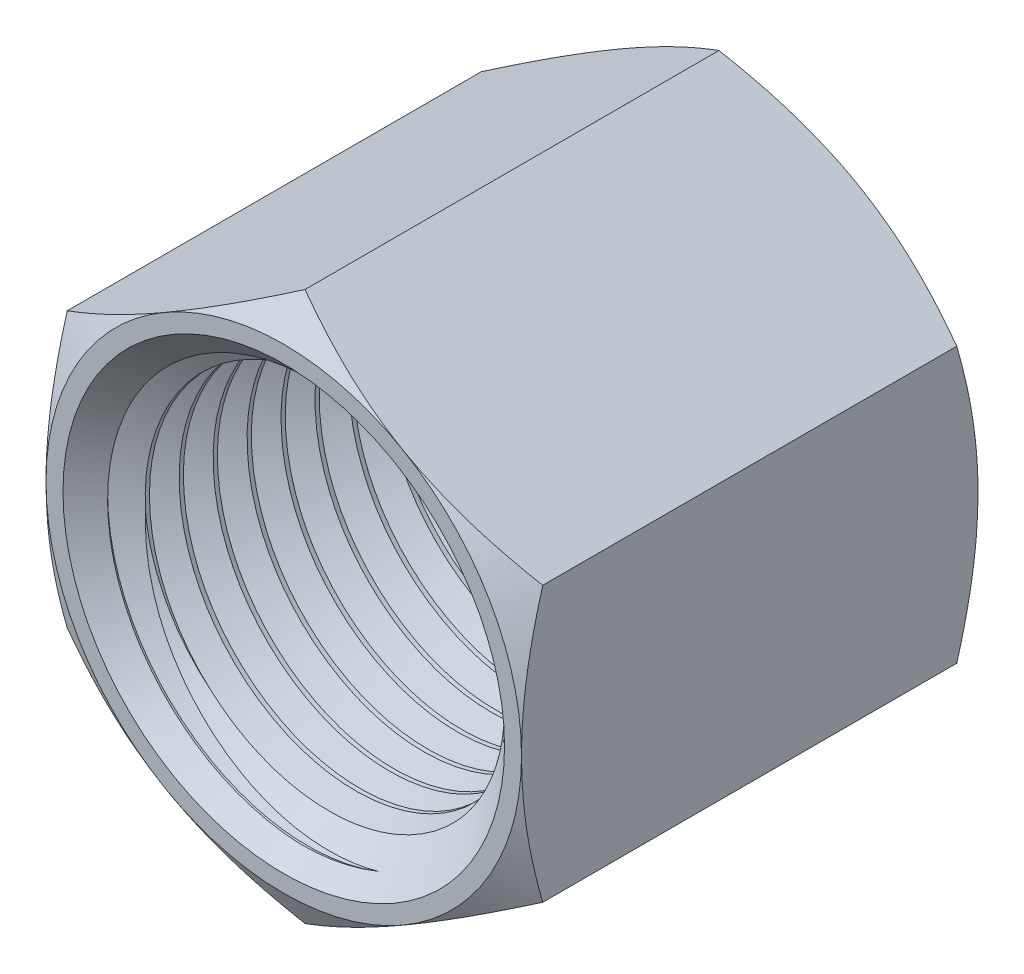
from build123d import *

# Parameters (mm, degrees)
BOSS_EXTRUDE1_DEPTH      = 10.668
BOSS_EXTRUDE1_DEPTH_BACK = 10.668
SKETCH2_R                = 7.239
SKETCH4_OUTSIDE_W        = 41.044
SKETCH4_OUTSIDE_H        = 44.482
SKETCH4_OUTSIDE_R        = 11.1125
CUT_EXTRUDE1_DEPTH       = 2.54
CUT_EXTRUDE1_DRAFT       = -60
MIRROR1_COPY_1_SKETCH_W  = 41.044
MIRROR1_COPY_1_SKETCH_H  = 44.482
MIRROR1_COPY_1_SKETCH_R  = 11.1125
MIRROR1_COPY_1_DEPTH     = 2.54
MIRROR1_COPY_1_DRAFT     = -60
SKETCH7_R                = 10.31875
BOSS_EXTRUDE2_DEPTH      = 15.748
SKETCH8_R                = 9.525
BOSS_EXTRUDE3_DEPTH      = 15.748
CUT_SWEEP1_PITCH         = 1.5875


with BuildPart() as part:
    # Sketch2 → Boss-Extrude1 (new, two sides: drawn at the far end of the back side and taken through both)
    with BuildSketch(Plane.XY.offset(-BOSS_EXTRUDE1_DEPTH_BACK)):
        Polygon((0, 12.831609733), (-11.1125, 6.415804866), (-11.1125, -6.415804866), (0, -12.831609733), (11.1125, -6.415804866), (11.1125, 6.415804866), align=None)
        Circle(SKETCH2_R, mode=Mode.SUBTRACT)
    extrude(amount=BOSS_EXTRUDE1_DEPTH + BOSS_EXTRUDE1_DEPTH_BACK)

    # Sketch3 → Cut-Revolve1 (revolve, cut)
    with BuildSketch(Plane(origin=(0, 0, 0), x_dir=(0, 0, -1), z_dir=(1, 0, 0)), mode=Mode.PRIVATE) as cut_revolve1_sk:
        Polygon((-10.668, 9.525), (5.08, 9.525), (5.08, 7.239), (10.668, 7.239), (10.668, 0), (-10.668, 0), align=None)
    revolve(cut_revolve1_sk.sketch.rotate(Axis((0, 0, 10.668), (0, 0, -1)), 180), axis=Axis((0, 0, 10.668), (0, 0, -1)), mode=Mode.SUBTRACT)


with BuildPart() as cut_extrude1_tool:
    # Sketch4 outside → Cut-Extrude1 (with draft: the straight prism first)
    with BuildSketch(Plane.XY.offset(10.668)):
        Rectangle(SKETCH4_OUTSIDE_W, SKETCH4_OUTSIDE_H)
        Circle(SKETCH4_OUTSIDE_R, mode=Mode.SUBTRACT)
    extrude(amount=-CUT_EXTRUDE1_DEPTH)
    # Cut-Extrude1: the draft: its side faces are tilted about the plane it starts from
    cut_extrude1_sides = [cut_extrude1_tool.faces().sort_by_distance(p)[0] for p in [
        (0, -22.241, 9.398),
        (20.522, 0, 9.398),
        (0, 22.241, 9.398),
        (-20.522, 0, 9.398),
        (-11.1125, 0, 9.398),
    ]]
    draft(cut_extrude1_sides, Plane.XY.offset(10.668), CUT_EXTRUDE1_DRAFT)


with BuildPart() as part_1:
    add(part.part)

    # Cut-Extrude1: cut by cut_extrude1_tool
    add(cut_extrude1_tool.part, mode=Mode.SUBTRACT)


with BuildPart() as mirror1_copy_1_tool:
    # Mirror1 copy 1 sketch → Mirror1 copy 1 (with draft: the straight prism first)
    with BuildSketch(Plane(origin=(0, 0, -10.668), x_dir=(1, 0, 0), z_dir=(0, 0, -1))):
        Rectangle(MIRROR1_COPY_1_SKETCH_W, MIRROR1_COPY_1_SKETCH_H)
        Circle(MIRROR1_COPY_1_SKETCH_R, mode=Mode.SUBTRACT)
    extrude(amount=-MIRROR1_COPY_1_DEPTH)
    # Mirror1 copy 1: the draft: its side faces are tilted about the plane it starts from
    mirror1_copy_1_sides = [mirror1_copy_1_tool.faces().sort_by_distance(p)[0] for p in [
        (0, -22.241, -9.398),
        (20.522, 0, -9.398),
        (0, 22.241, -9.398),
        (-20.522, 0, -9.398),
        (-11.1125, 0, -9.398),
    ]]
    draft(mirror1_copy_1_sides, Plane(origin=(0, 0, -10.668), x_dir=(1, 0, 0), z_dir=(0, 0, -1)), MIRROR1_COPY_1_DRAFT)


with BuildPart() as part_2:
    add(part_1.part)

    # Mirror1 copy 1: cut by mirror1_copy_1_tool
    add(mirror1_copy_1_tool.part, mode=Mode.SUBTRACT)

    # Cut-Extrude2 cone 1 section (through the dimple's axis) → Cut-Extrude2 (revolve, cut)
    with BuildSketch(Plane(origin=(0, 0, 10.668), x_dir=(0, -1, 0), z_dir=(1, 0, 0))):
        Polygon((0, 0), (10.31875, 0), (0, 10.31875), align=None)
    revolve(axis=Axis((0, 0, 10.668), (0, 0, -1)), mode=Mode.SUBTRACT)

    # Sketch7 → Boss-Extrude2 (add)
    with BuildSketch(Plane.XY.offset(10.668)):
        Circle(SKETCH7_R)
    extrude(amount=-BOSS_EXTRUDE2_DEPTH)


with BuildPart() as body_2:
    # Sketch8 → Boss-Extrude3 (new body)
    with BuildSketch(Plane.XY.offset(10.668)):
        Circle(SKETCH8_R)
    extrude(amount=-BOSS_EXTRUDE3_DEPTH)

    # Cut-Sweep1: the profile of Sketch9 profile screwed along a right-hand helix of 10.92 turns, 8 arcs to a turn; built about Z, then put on its axis
    cut_sweep1_z = Axis((0, 0, 0), (0, 0, 1))
    cut_sweep1_corners = [(9.5253, 0, 0.000173205), (8.407962546, 0, -0.644921875), (8.407962546, 0, -0.843359375), (9.5253, 0, -1.488454455)]
    with BuildLine(mode=Mode.PRIVATE) as cut_sweep1_profile:
        Line(cut_sweep1_corners[0], cut_sweep1_corners[1])
        Line(cut_sweep1_corners[1], cut_sweep1_corners[2])
        Line(cut_sweep1_corners[2], cut_sweep1_corners[3])
        Line(cut_sweep1_corners[3], cut_sweep1_corners[0])
    cut_sweep1_cap = Face(cut_sweep1_profile.wire())
    cut_sweep1_turn_angles = [0, 22.5, 45, 67.5, 90, 112.5, 135, 157.5, 180, 202.5, 225, 247.5, 270, 292.5, 315, 337.5, 360]
    cut_sweep1_turn_weights = [1, 0.9238795325112867, 1, 0.9238795325112867, 1, 0.9238795325112867, 1, 0.9238795325112867, 1, 0.9238795325112867, 1, 0.9238795325112867, 1, 0.9238795325112867, 1, 0.9238795325112867, 1]
    cut_sweep1_turn_rails = [Edge.make_bspline([Vector(p[0], p[1], 0).rotate(cut_sweep1_z, cut_sweep1_turn_angles[k]) / cut_sweep1_turn_weights[k] + Vector(0, 0, p[2] + CUT_SWEEP1_PITCH * cut_sweep1_turn_angles[k] / 360) for k in range(17)], [0, 0, 0, 1, 1, 2, 2, 3, 3, 4, 4, 5, 5, 6, 6, 7, 7, 8, 8, 8], 2, cut_sweep1_turn_weights) for p in cut_sweep1_corners]
    cut_sweep1_turn_sides = [Face.make_surface_from_curves(cut_sweep1_turn_rails[p[0]], cut_sweep1_turn_rails[p[1]]) for p in [(0, 1), (1, 2), (2, 3), (3, 0)]]
    cut_sweep1_last_angles = [3600, 3622.5, 3645, 3667.5, 3690, 3712.5, 3735, 3757.5, 3780, 3802.5, 3825, 3847.5, 3870, 3892.5, 3915, 3923.1, 3931.2]
    cut_sweep1_last_weights = [1, 0.9238795325112867, 1, 0.9238795325112867, 1, 0.9238795325112867, 1, 0.9238795325112867, 1, 0.9238795325112867, 1, 0.9238795325112867, 1, 0.9238795325112867, 1, 0.9900236577165605, 1]
    cut_sweep1_last_rails = [Edge.make_bspline([Vector(p[0], p[1], 0).rotate(cut_sweep1_z, cut_sweep1_last_angles[k]) / cut_sweep1_last_weights[k] + Vector(0, 0, p[2] + CUT_SWEEP1_PITCH * cut_sweep1_last_angles[k] / 360) for k in range(17)], [0, 0, 0, 1, 1, 2, 2, 3, 3, 4, 4, 5, 5, 6, 6, 7, 7, 8, 8, 8], 2, cut_sweep1_last_weights) for p in cut_sweep1_corners]
    cut_sweep1_last_sides = [Face.make_surface_from_curves(cut_sweep1_last_rails[p[0]], cut_sweep1_last_rails[p[1]]) for p in [(0, 1), (1, 2), (2, 3), (3, 0)]]
    cut_sweep1 = Plane(origin=(0, 0, 10.668), x_dir=(0, 1, 0), z_dir=(0, 0, -1)) * Solid(Shell([*[p.moved(Location((0, 0, CUT_SWEEP1_PITCH * i))) for i in range(10) for p in cut_sweep1_turn_sides], *cut_sweep1_last_sides, cut_sweep1_cap, cut_sweep1_cap.rotate(cut_sweep1_z, 3931.2).moved(Location((0, 0, CUT_SWEEP1_PITCH * 3931.2 / 360)))]))
    add(cut_sweep1, mode=Mode.SUBTRACT)


with BuildPart() as part_3:
    add(part_2.part)

    # Combine1: cut body 2
    add(body_2.part, mode=Mode.SUBTRACT)

    # Cut-Extrude3 cone 1 section (through the dimple's axis) → Cut-Extrude3 (revolve, cut)
    with BuildSketch(Plane(origin=(0, 0, 10.668), x_dir=(0, -1, 0), z_dir=(1, 0, 0))):
        Polygon((0, 0), (10.31875, 0), (0, 10.31875), align=None)
    revolve(axis=Axis((0, 0, 10.668), (0, 0, -1)), mode=Mode.SUBTRACT)


solid = part_3.part
